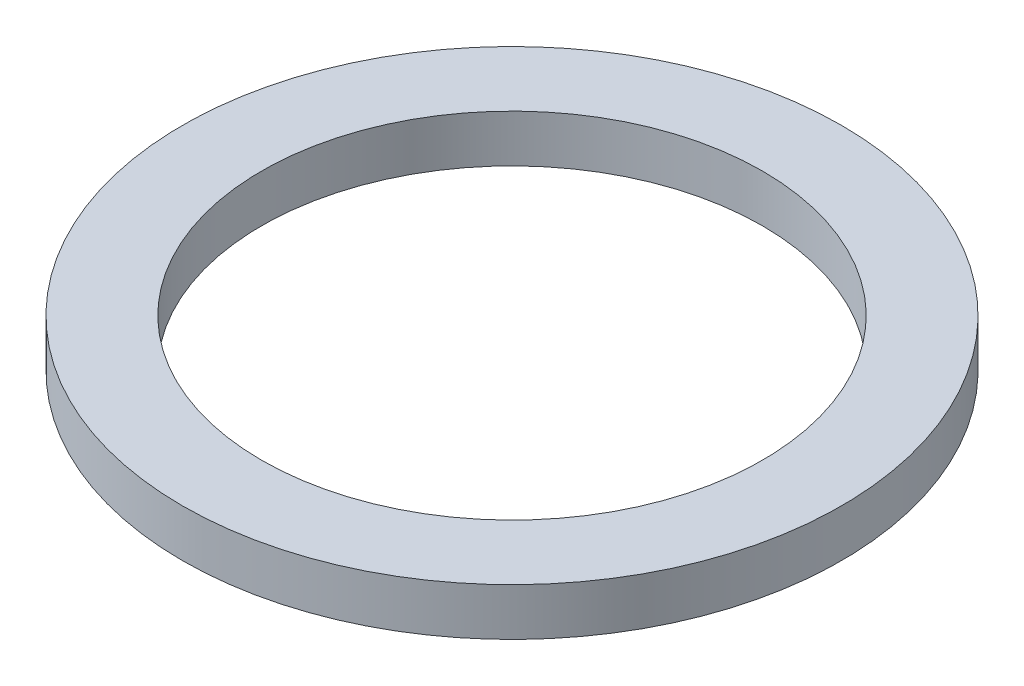
from build123d import *

# Parameters (mm, degrees)
SKETCH1_R           = 62.5
BOSS_EXTRUDE1_DEPTH = 9
SKETCH2_R           = 47.5
CUT_EXTRUDE1_DEPTH  = 89.845371292


with BuildPart() as part:
    # Sketch1 → Boss-Extrude1 (new body)
    with BuildSketch(Plane(origin=(0, 0, 0), x_dir=(1, 0, 0), z_dir=(0, 1, 0))):
        Circle(SKETCH1_R)
    extrude(amount=BOSS_EXTRUDE1_DEPTH)

    # Sketch2 → Cut-Extrude1 (cut, through all)
    with BuildSketch(Plane(origin=(0, 0, 0), x_dir=(1, 0, 0), z_dir=(0, 1, 0))):
        Circle(SKETCH2_R)
    extrude(amount=CUT_EXTRUDE1_DEPTH, mode=Mode.SUBTRACT)


solid = part.part
